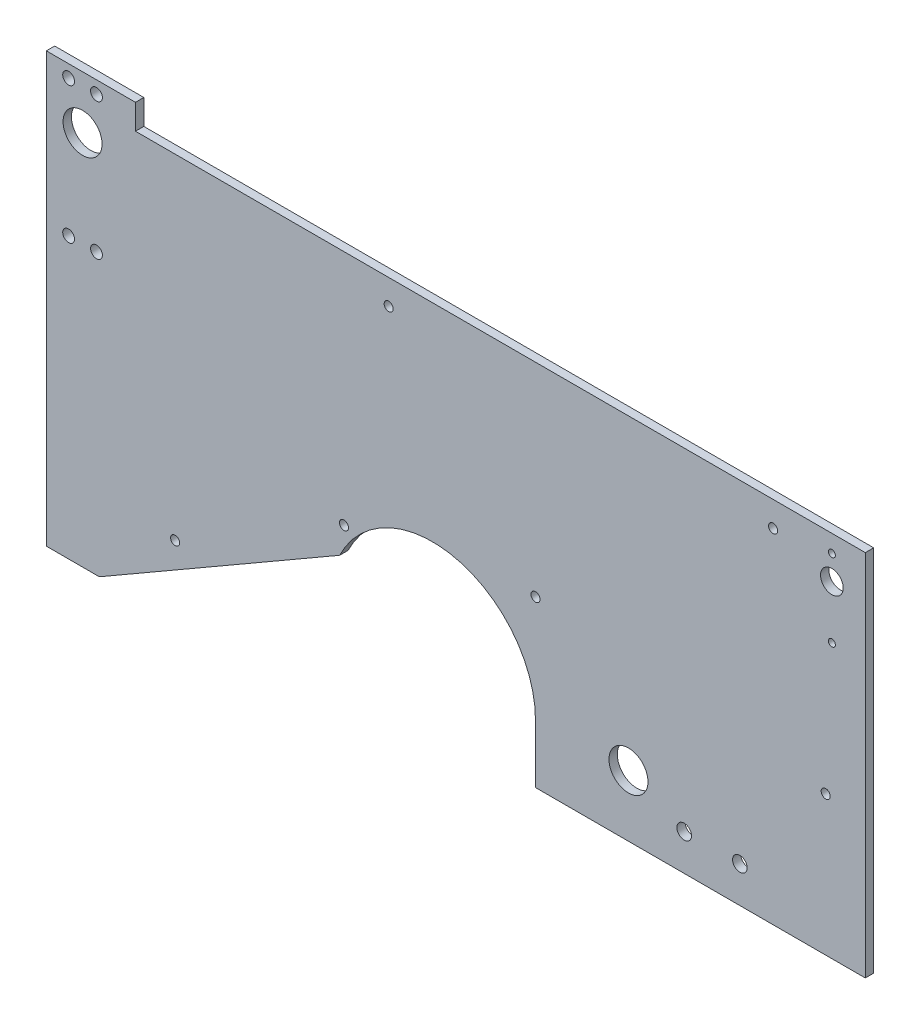
from build123d import *

# Parameters (mm, degrees)
SKETCH2_R           = 7
SKETCH2_R_2         = 2.125
BOSS_EXTRUDE2_DEPTH = 3
SKETCH3_W           = 118.4
SKETCH3_H           = 12.75
CUT_EXTRUDE1_DEPTH  = 338.231374578
SKETCH5_R           = 2.625
SKETCH5_R_2         = 4.075
SKETCH5_R_3         = 1.25
SKETCH5_R_4         = 1.625
SKETCH5_R_5         = 7
SKETCH5_W           = 6
SKETCH5_H           = 154
CUT_EXTRUDE2_DEPTH  = 338.231374578


with BuildPart() as part:
    # Sketch2 → Boss-Extrude2 (new body)
    with BuildSketch(Plane.XY):
        with BuildLine():
            Line((25.03035901, 0), (111.286489227, 49.8))
            ThreePointArc((111.286489227, 49.8), (152.858332199, 69.766604349), (181.6, 33.7))
            Line((181.6, 33.7), (181.6, 0))
            Line((181.6, 0), (300, 0))
            Line((300, 0), (300, 145))
            Line((300, 145), (38, 145))
            Line((38, 145), (38, 154))
            Line((38, 154), (19, 154))
            Line((19, 154), (0, 154))
            Line((0, 154), (0, 0))
            Line((0, 0), (25.03035901, 0))
        make_face()
        with Locations((19, 135)):
            Circle(SKETCH2_R, mode=Mode.SUBTRACT)
        with Locations((14, 149.5)):
            Circle(SKETCH2_R_2, mode=Mode.SUBTRACT)
        with Locations((24, 149.5)):
            Circle(SKETCH2_R_2, mode=Mode.SUBTRACT)
        with Locations((24, 100.5)):
            Circle(SKETCH2_R_2, mode=Mode.SUBTRACT)
        with Locations((14, 100.5)):
            Circle(SKETCH2_R_2, mode=Mode.SUBTRACT)
    extrude(amount=BOSS_EXTRUDE2_DEPTH)

    # Sketch3 → Cut-Extrude1 (cut, through all)
    with BuildSketch(Plane.XY.offset(3)):
        with Locations((240.8, 6.375)):
            Rectangle(SKETCH3_W, SKETCH3_H)
    extrude(amount=-CUT_EXTRUDE1_DEPTH, mode=Mode.SUBTRACT)

    # Sketch5 → Cut-Extrude2 (cut, through all)
    with BuildSketch(Plane.XY.offset(3)):
        with Locations((254.98, 25.75)):
            Circle(SKETCH5_R)
        with Locations((234.98, 25.75)):
            Circle(SKETCH5_R)
        with Locations((288, 130)):
            Circle(SKETCH5_R_2)
        with Locations((288, 138.75)):
            Circle(SKETCH5_R_3)
        with Locations((288, 110.95)):
            Circle(SKETCH5_R_3)
        with Locations((285.78, 62.92)):
            Circle(SKETCH5_R_4)
        with Locations((181.6, 72.03)):
            Circle(SKETCH5_R_4)
        with Locations((52.23, 24.91)):
            Circle(SKETCH5_R_4)
        with Locations((112.84, 59.93)):
            Circle(SKETCH5_R_4)
        with Locations((266.895, 135.995)):
            Circle(SKETCH5_R_4)
        with Locations((128.895, 135.995)):
            Circle(SKETCH5_R_4)
        with Locations((214.98, 34.75)):
            Circle(SKETCH5_R_5)
        with Locations((3, 77)):
            Rectangle(SKETCH5_W, SKETCH5_H)
    extrude(amount=-CUT_EXTRUDE2_DEPTH, mode=Mode.SUBTRACT)


solid = part.part
